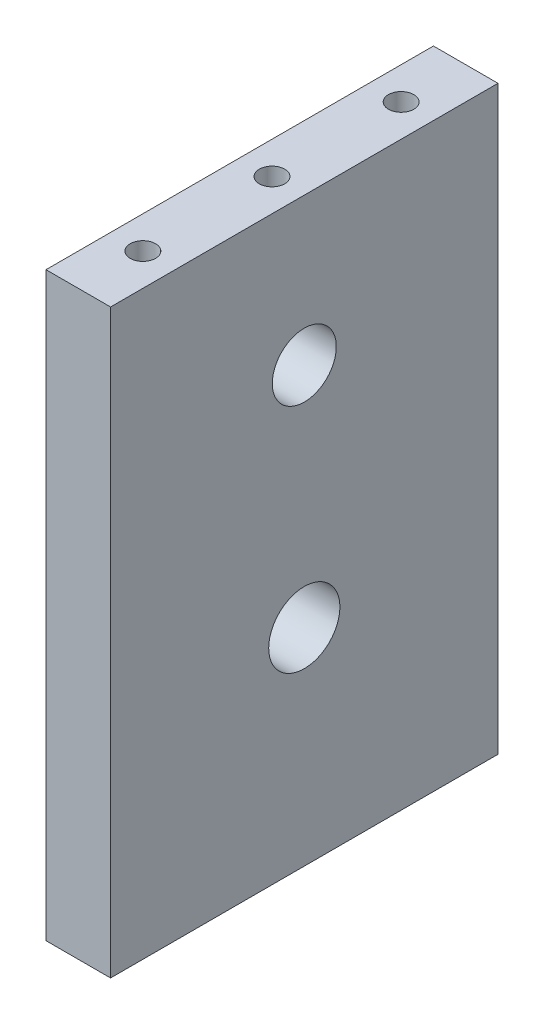
from build123d import *

# Parameters (mm, degrees)
BOSS_EXTRUDE1_DEPTH = 38.1
SKETCH2_R           = 3.5
CUT_EXTRUDE1_DEPTH  = 6.35
SKETCH2_4_R         = 3.148
CUT_EXTRUDE2_DEPTH  = 6.35
SKETCH4_W           = 94.447991824
SKETCH4_H           = 31.75
CUT_EXTRUDE5_DEPTH  = 76.2
SKETCH5_W           = 38.1
SKETCH5_H           = 12.7
CUT_EXTRUDE6_DEPTH  = 6.35
SKETCH8_R           = 1.25
CUT_EXTRUDE7_DEPTH  = 6.35


with BuildPart() as part:
    # Sketch1 → Boss-Extrude1 (new body)
    with BuildSketch(Plane.XY):
        Polygon((0, 76.2), (0, 0), (6.35, 0), (6.35, 69.85), (94.447991824, 69.85), (94.447991824, 101.6), (88.097991824, 101.6), (88.097991824, 76.2), align=None)
    extrude(amount=BOSS_EXTRUDE1_DEPTH)

    # Sketch2 → Cut-Extrude1 (cut)
    with BuildSketch(Plane.ZY):
        with Locations((19.05, 20.32)):
            Circle(SKETCH2_R)
    extrude(amount=-CUT_EXTRUDE1_DEPTH, mode=Mode.SUBTRACT)

    # Sketch2<4> → Cut-Extrude2 (cut)
    with BuildSketch(Plane.ZY):
        with Locations((19.05, 42.672)):
            Circle(SKETCH2_4_R)
    extrude(amount=-CUT_EXTRUDE2_DEPTH, mode=Mode.SUBTRACT)

    # Sketch4 → Cut-Extrude5 (cut)
    with BuildSketch(Plane.XY.offset(38.1)):
        with Locations((47.223995912, 85.725)):
            Rectangle(SKETCH4_W, SKETCH4_H)
    extrude(amount=-CUT_EXTRUDE5_DEPTH, mode=Mode.SUBTRACT)

    # Sketch5 → Cut-Extrude6 (cut)
    with BuildSketch(Plane(origin=(6.35, 0, 0), x_dir=(0, 0, -1), z_dir=(1, 0, 0))):
        with Locations((-19.05, 63.5)):
            Rectangle(SKETCH5_W, SKETCH5_H)
    extrude(amount=-CUT_EXTRUDE6_DEPTH, mode=Mode.SUBTRACT)

    # Sketch8 → Cut-Extrude7 (cut)
    with BuildSketch(Plane(origin=(0, 57.15, 0), x_dir=(1, 0, 0), z_dir=(0, 1, 0))):
        with Locations((3.175, -6.35)):
            Circle(SKETCH8_R)
        with Locations((3.175, -31.75)):
            Circle(SKETCH8_R)
        with Locations((3.175, -19.05)):
            Circle(SKETCH8_R)
    extrude(amount=-CUT_EXTRUDE7_DEPTH, mode=Mode.SUBTRACT)


solid = part.part
